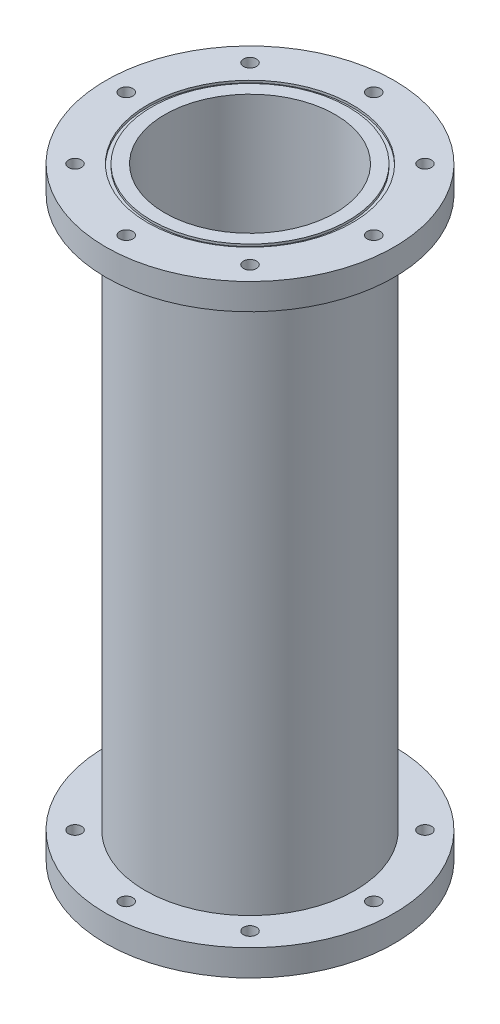
from build123d import *

# Parameters (mm, degrees)
SKETCH2_R               = 50.8
SKETCH2_R_2             = 41.275
BASE_CYLINDER_DEPTH     = 292.1
SKETCH3_R               = 69.85
SKETCH3_R_2             = 41.275
AFT_FLANGE_DEPTH        = 12.7
FORWARD_START           = -12.7
SKETCH4_R               = 69.85
SKETCH4_R_2             = 41.275
FORWARD_FLANGE_DEPTH    = 12.7
SKETCH6_R               = 49.4792
SKETCH6_R_2             = 47.625
O_RING_SLOT_1_DEPTH     = 1.1176
O_RING_START            = -1.1176
SKETCH7_R               = 49.53
SKETCH7_R_2             = 47.625
O_RING_SLOT_2_DEPTH     = 1.1176
CUT_EXTRUDE4_DEPTH      = 309.351187771
CUT_EXTRUDE4_DEPTH_BACK = 309.351187771
SKETCH8_R               = 3.175


with BuildPart() as part:
    # Sketch2 → Base Cylinder (new body)
    with BuildSketch(Plane(origin=(0, 0, 0), x_dir=(1, 0, 0), z_dir=(0, 1, 0))):
        Circle(SKETCH2_R)
        Circle(SKETCH2_R_2, mode=Mode.SUBTRACT)
    extrude(amount=BASE_CYLINDER_DEPTH)

    # Sketch3 → Aft Flange (add)
    with BuildSketch(Plane.XZ):
        Circle(SKETCH3_R)
        Circle(SKETCH3_R_2, mode=Mode.SUBTRACT)
    extrude(amount=-AFT_FLANGE_DEPTH)

    # Sketch4 → Forward Flange (add)
    with BuildSketch(Plane(origin=(0, 292.1, 0), x_dir=(1, 0, 0), z_dir=(0, 1, 0)).offset(FORWARD_START)):
        Circle(SKETCH4_R)
        Circle(SKETCH4_R_2, mode=Mode.SUBTRACT)
    extrude(amount=FORWARD_FLANGE_DEPTH)

    # Sketch6 → O-Ring Slot 1 (cut)
    with BuildSketch(Plane.XZ):
        Circle(SKETCH6_R)
        Circle(SKETCH6_R_2, mode=Mode.SUBTRACT)
    extrude(amount=-O_RING_SLOT_1_DEPTH, mode=Mode.SUBTRACT)

    # Sketch7 → O-Ring Slot 2 (cut)
    with BuildSketch(Plane(origin=(0, 292.1, 0), x_dir=(1, 0, 0), z_dir=(0, 1, 0)).offset(O_RING_START)):
        Circle(SKETCH7_R)
        Circle(SKETCH7_R_2, mode=Mode.SUBTRACT)
    extrude(amount=O_RING_SLOT_2_DEPTH, mode=Mode.SUBTRACT)

    # Sketch8 → Cut-Extrude4 (cut, two sides: drawn at the far end of the back side and taken through both)
    with BuildSketch(Plane.XZ.offset(-CUT_EXTRUDE4_DEPTH_BACK)):
        with Locations((-59.9186, 0)):
            Circle(SKETCH8_R)
        with Locations((-42.368848379, 42.368848379)):
            Circle(SKETCH8_R)
        with Locations((0, 59.9186)):
            Circle(SKETCH8_R)
        with Locations((42.368848379, 42.368848379)):
            Circle(SKETCH8_R)
        with Locations((59.9186, 0)):
            Circle(SKETCH8_R)
        with Locations((42.368848379, -42.368848379)):
            Circle(SKETCH8_R)
        with Locations((0, -59.9186)):
            Circle(SKETCH8_R)
        with Locations((-42.368848379, -42.368848379)):
            Circle(SKETCH8_R)
    extrude(amount=CUT_EXTRUDE4_DEPTH + CUT_EXTRUDE4_DEPTH_BACK, mode=Mode.SUBTRACT)


solid = part.part
